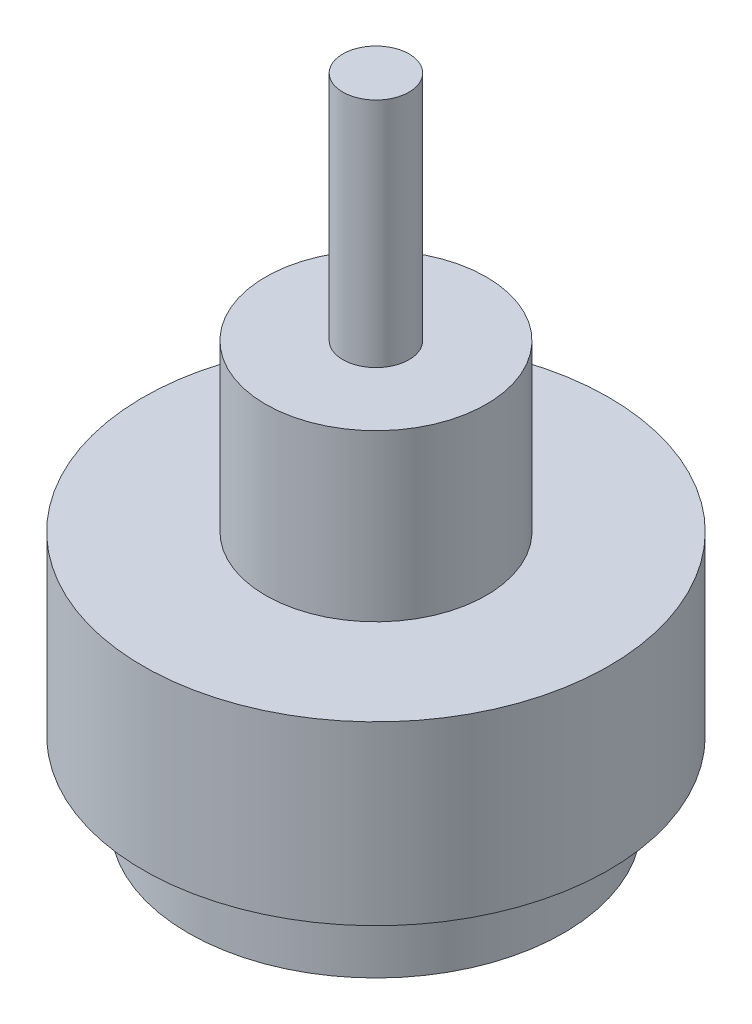
from build123d import *

# Parameters (mm, degrees)
BOSS_EXTRUDE1_DEPTH   = 8
BOSS_EXTRUDE2_START   = 8
SKETCH2_3_R           = 10
BOSS_EXTRUDE2_DEPTH   = 15
BOSS_EXTRUDE3_START   = 23
SKETCH2_4_R           = 3
BOSS_EXTRUDE3_DEPTH   = 21
BOSS_EXTRUDE4_START   = -15
SKETCH2_5_R           = 17
SKETCH2_5_R_2         = 1.5
SKETCH2_5_R_3         = 3
BOSS_EXTRUDE4_DEPTH   = 7
BOSS_EXTRUDE5_START   = -14
BOSS_EXTRUDE5_DEPTH   = 6
BOSS_EXTRUDE5_2_DEPTH = 6


# Read off the part's stored shape, not the designer's step: Boss-Extrude5
with BuildPart() as part:
    # Sketch2 → Boss-Extrude1 (new, symmetric)
    with BuildSketch(Plane(origin=(0, 0, 0), x_dir=(1, 0, 0), z_dir=(0, 1, 0))):
        with BuildLine():
            ThreePointArc((-19.553646138, 7.928740297), (17.082571878, -12.385303308), (-13.615145539, 16.119485474))
            add(Edge.make_bspline(
                [(-19.553646138, 7.928740297), (-17.447949133, 12.882150211), (-13.615145539, 16.119485474)],
                knots=[0, 0, 0, 0.780076173, 0.780076173, 0.780076173], degree=2))
        make_face()
    extrude(amount=BOSS_EXTRUDE1_DEPTH, both=True)

    # Sketch2<3> → Boss-Extrude2 (add)
    with BuildSketch(Plane(origin=(0, 0, 0), x_dir=(1, 0, 0), z_dir=(0, 1, 0)).offset(BOSS_EXTRUDE2_START)):
        with Locations(Location((0, 0, 0), (0, 0, 270))):
            Circle(SKETCH2_3_R)
    extrude(amount=BOSS_EXTRUDE2_DEPTH)

    # Sketch2<4> → Boss-Extrude3 (add)
    with BuildSketch(Plane(origin=(0, 0, 0), x_dir=(1, 0, 0), z_dir=(0, 1, 0)).offset(BOSS_EXTRUDE3_START)):
        with Locations(Location((0, 0, 0), (0, 0, 90))):
            Circle(SKETCH2_4_R)
    extrude(amount=BOSS_EXTRUDE3_DEPTH)

    # Sketch2<5> → Boss-Extrude4 (add)
    with BuildSketch(Plane(origin=(0, 0, 0), x_dir=(1, 0, 0), z_dir=(0, 1, 0)).offset(BOSS_EXTRUDE4_START)):
        with Locations(Location((0, 0, 0), (0, 0, 270))):
            Circle(SKETCH2_5_R)
        with Locations(Location((0, 12.5, 0), (0, 0, 270))):
            Circle(SKETCH2_5_R_2, mode=Mode.SUBTRACT)
        with Locations(Location((-9.5, 0, 0), (0, 0, 270))):
            Circle(SKETCH2_5_R_2, mode=Mode.SUBTRACT)
        with Locations(Location((9.5, 0, 0), (0, 0, 270))):
            Circle(SKETCH2_5_R_2, mode=Mode.SUBTRACT)
        with Locations(Location((0, -12.5, 0), (0, 0, 270))):
            Circle(SKETCH2_5_R_2, mode=Mode.SUBTRACT)
        with Locations(Location((0, 0, 0), (0, 0, 90))):
            Circle(SKETCH2_5_R_3, mode=Mode.SUBTRACT)
    extrude(amount=BOSS_EXTRUDE4_DEPTH)

    # Boss-Extrude5 2 outline → Boss-Extrude5 2 (add)
    with BuildSketch(Plane(origin=(0, 0, 0), x_dir=(1, 0, 0), z_dir=(0, 1, 0)).offset(BOSS_EXTRUDE5_START)):
        with BuildLine():
            add(Edge.make_bspline(
                [(-19.553646138, 7.928740297), (-17.447949162, 12.882150142), (-13.615145647, 16.119485383)],
                knots=[0, 0, 0, 1, 1, 1], degree=2))
            Line((-19.553646138, 7.928740297), (-15.889340318, 6.043911337))
            ThreePointArc((-15.889340318, 6.043911337), (-13.34797436, 10.527657883), (-9.579771413, 14.043787939))
            Line((-9.579771413, 14.043787939), (-13.615145647, 16.119485383))
        make_face()
    extrude(amount=BOSS_EXTRUDE5_2_DEPTH)


with BuildPart() as body_2:
    # Boss-Extrude5 outline → Boss-Extrude5 (new body)
    with BuildSketch(Plane(origin=(0, 0, 0), x_dir=(1, 0, 0), z_dir=(0, 1, 0)).offset(BOSS_EXTRUDE5_START)):
        with BuildLine():
            Line((-19.337935144, 19.063147812), (-23.912046336, 10.170594366))
            Line((-23.912046336, 10.170594366), (-19.553646138, 7.928740297))
            ThreePointArc((-19.553646138, 7.928740297), (-17.08257192, 12.385303251), (-13.615145647, 16.119485383))
            Line((-13.615145647, 16.119485383), (-19.337935144, 19.063147812))
        make_face()
    extrude(amount=BOSS_EXTRUDE5_DEPTH)


solid = Compound([part.part, body_2.part])
